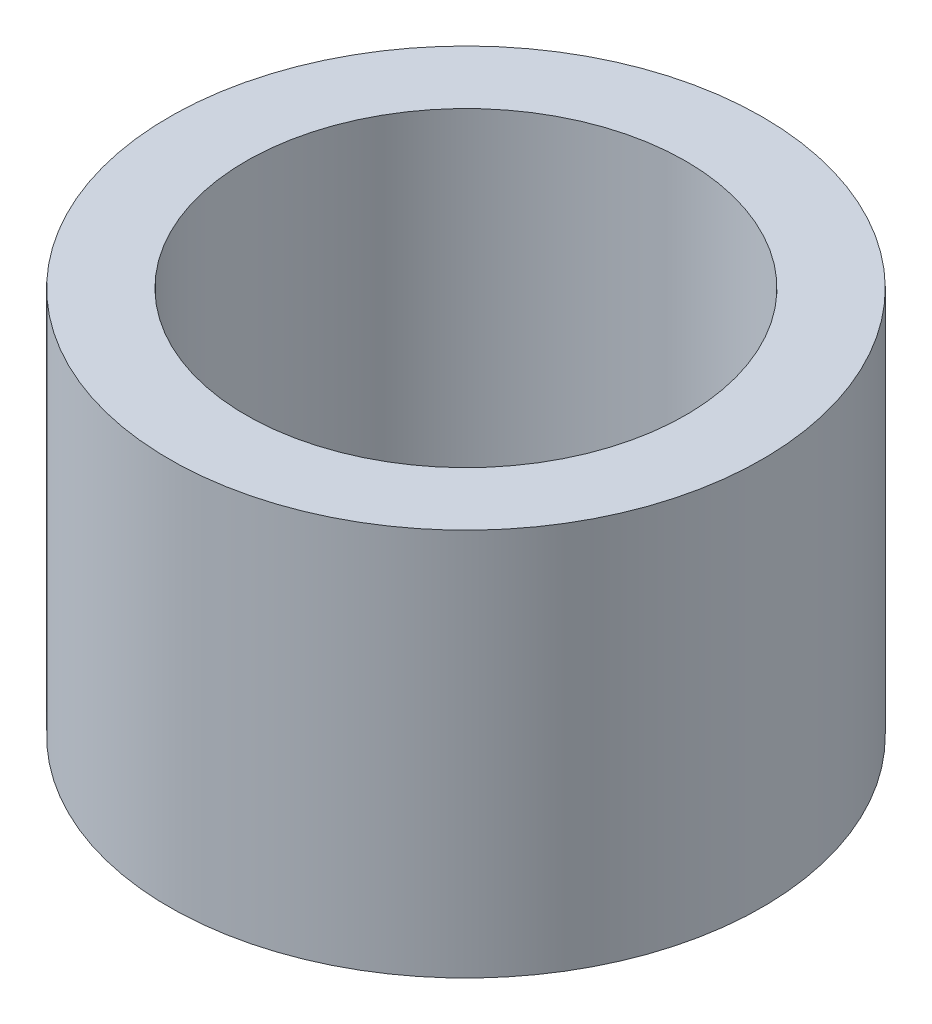
from build123d import *

# Parameters (mm, degrees)
SKETCH1_R           = 10
BOSS_EXTRUDE1_DEPTH = 13.08090653
SKETCH2_R           = 7.417229824
CUT_EXTRUDE1_DEPTH  = 20.264218532


with BuildPart() as part:
    # Sketch1 → Boss-Extrude1 (new body)
    with BuildSketch(Plane(origin=(0, 0, 0), x_dir=(1, 0, 0), z_dir=(0, 1, 0))):
        Circle(SKETCH1_R)
    extrude(amount=BOSS_EXTRUDE1_DEPTH)

    # Sketch2 → Cut-Extrude1 (cut, through all)
    with BuildSketch(Plane(origin=(0, 0, 0), x_dir=(1, 0, 0), z_dir=(0, 1, 0))):
        Circle(SKETCH2_R)
    extrude(amount=CUT_EXTRUDE1_DEPTH, mode=Mode.SUBTRACT)


solid = part.part
